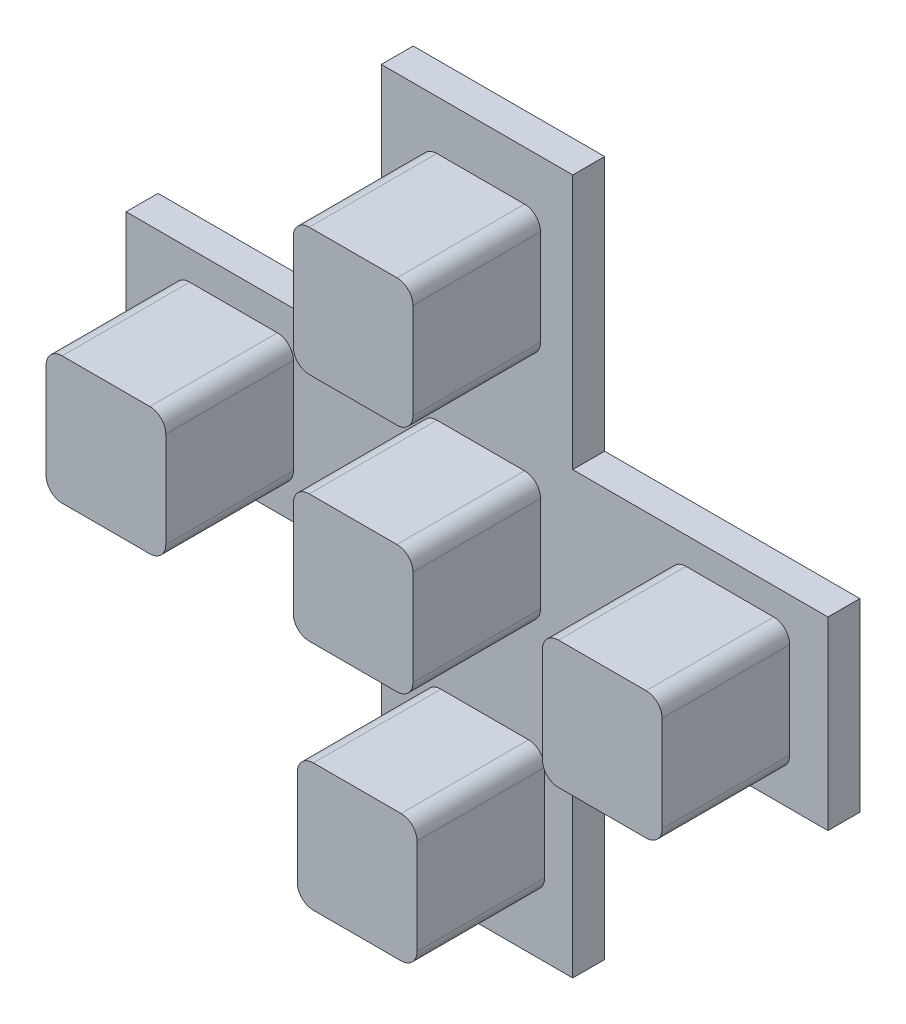
from build123d import *

# Parameters (mm, degrees)
SKETCH1_W             = 7.5000007
SKETCH1_H             = 8
BOSS_EXTRUDE1_DEPTH   = 8
BOSS_EXTRUDE1_2_DEPTH = 8
SKETCH1_W_2           = 7.500000349
SKETCH1_H_2           = 7.999999673
BOSS_EXTRUDE1_3_DEPTH = 8
SKETCH1_W_3           = 7.500000699
SKETCH1_H_3           = 7.999999344
BOSS_EXTRUDE1_4_DEPTH = 8
SKETCH1_W_4           = 7.50000035
SKETCH1_H_4           = 7.999999672
BOSS_EXTRUDE1_5_DEPTH = 8
BOSS_EXTRUDE2_DEPTH   = 2
FILLET1_R             = 1
FILLET2_R             = 1
FILLET3_R             = 1
FILLET4_R             = 1
FILLET5_R             = 1
SHELL8_START          = -2
SHELL8_OUTLINE_W      = 5.5000007
SHELL8_OUTLINE_H      = 6
SHELL8_OUTLINE_W_2    = 5.500000349
SHELL8_OUTLINE_H_2    = 5.999999673
SHELL8_OUTLINE_W_3    = 5.500000699
SHELL8_OUTLINE_H_3    = 5.999999344
SHELL8_OUTLINE_W_4    = 5.50000035
SHELL8_OUTLINE_H_4    = 5.999999672
SHELL8_DEPTH          = 9
SHELL8_2_OUTLINE_W    = 5.50000035
SHELL8_2_OUTLINE_H    = 5.999999672
SHELL8_2_OUTLINE_W_2  = 5.500000699
SHELL8_2_OUTLINE_H_2  = 5.999999344
SHELL8_2_OUTLINE_W_3  = 5.5000007
SHELL8_2_OUTLINE_H_3  = 6
SHELL8_2_OUTLINE_W_4  = 5.500000349
SHELL8_2_OUTLINE_H_4  = 5.999999673
SHELL8_2_DEPTH        = 1


# Read off the part's stored shape, not the designer's step: Shell8
with BuildPart() as part:
    # Sketch1 → Boss-Extrude1 (new body)
    with BuildSketch(Plane.XY):
        with Locations((-28.369785759, -4.064003029)):
            Rectangle(SKETCH1_W, SKETCH1_H)
    extrude(amount=BOSS_EXTRUDE1_DEPTH)



with BuildPart() as body_2:
    # Sketch1 → Boss-Extrude1 2 (new body)
    with BuildSketch(Plane.XY):
        with Locations((-28.369785759, -18.542000511)):
            Rectangle(SKETCH1_W, SKETCH1_H)
    extrude(amount=BOSS_EXTRUDE1_2_DEPTH)


with BuildPart() as body_3:
    # Sketch1 → Boss-Extrude1 3 (new body)
    with BuildSketch(Plane.XY):
        with Locations((-12.748787377, -18.668999085)):
            Rectangle(SKETCH1_W_2, SKETCH1_H_2)
    extrude(amount=BOSS_EXTRUDE1_3_DEPTH)


with BuildPart() as body_4:
    # Sketch1 → Boss-Extrude1 4 (new body)
    with BuildSketch(Plane.XY):
        with Locations((-28.115787957, -33.019997009)):
            Rectangle(SKETCH1_W_3, SKETCH1_H_3)
    extrude(amount=BOSS_EXTRUDE1_4_DEPTH)


with BuildPart() as body_5:
    # Sketch1 → Boss-Extrude1 5 (new body)
    with BuildSketch(Plane.XY):
        with Locations((-43.86378524, -18.795997986)):
            Rectangle(SKETCH1_W_4, SKETCH1_H_4)
    extrude(amount=BOSS_EXTRUDE1_5_DEPTH)


with BuildPart() as part_1:
    add(part.part)

    add(body_2.part)  # Boss-Extrude2 merges body 2

    add(body_3.part)  # Boss-Extrude2 merges body 3

    add(body_4.part)  # Boss-Extrude2 merges body 4

    add(body_5.part)  # Boss-Extrude2 merges body 5
    # Sketch3 → Boss-Extrude2 (add)
    with BuildSketch(Plane(origin=(0, 0, 0), x_dir=(-1, 0, 0), z_dir=(0, 0, -1))):
        Polygon((22.599963615, -12.968328574), (6.599963615, -12.968328574), (6.599963615, -24.568328574), (22.599963615, -24.568328574), (22.599963615, -40.568328574), (34.599963615, -40.568328574), (34.599963615, -24.568328574), (50.599963615, -24.568328574), (50.599963615, -12.968328574), (34.599963615, -12.968328574), (34.599963615, 3.031671426), (22.599963615, 3.031671426), align=None)
    extrude(amount=BOSS_EXTRUDE2_DEPTH)

    # Fillet1
    fillet1_edges = [part_1.edges().sort_by_distance(p)[0] for p in [
        (-31.865788306, -29.019997337, 4),
        (-31.865788306, -37.019996681, 4),
        (-24.365787607, -37.019996681, 4),
        (-24.365787607, -29.019997337, 4),
    ]]
    fillet(fillet1_edges, radius=FILLET1_R)

    # Fillet2
    fillet2_edges = [part_1.edges().sort_by_distance(p)[0] for p in [
        (-32.119786109, -14.542000511, 4),
        (-32.119786109, -22.542000511, 4),
        (-24.619785409, -22.542000511, 4),
        (-24.619785409, -14.542000511, 4),
    ]]
    fillet(fillet2_edges, radius=FILLET2_R)

    # Fillet3
    fillet3_edges = [part_1.edges().sort_by_distance(p)[0] for p in [
        (-47.613785415, -14.79599815, 4),
        (-47.613785415, -22.795997822, 4),
        (-40.113785065, -22.795997822, 4),
        (-40.113785065, -14.79599815, 4),
    ]]
    fillet(fillet3_edges, radius=FILLET3_R)

    # Fillet4
    fillet4_edges = [part_1.edges().sort_by_distance(p)[0] for p in [
        (-32.119786109, -0.064003029, 4),
        (-24.619785409, -0.064003029, 4),
        (-24.619785409, -8.064003029, 4),
        (-32.119786109, -8.064003029, 4),
    ]]
    fillet(fillet4_edges, radius=FILLET4_R)

    # Fillet5
    fillet5_edges = [part_1.edges().sort_by_distance(p)[0] for p in [
        (-16.498787551, -14.668999248, 4),
        (-16.498787551, -22.668998921, 4),
        (-8.998787202, -22.668998921, 4),
        (-8.998787202, -14.668999248, 4),
    ]]
    fillet(fillet5_edges, radius=FILLET5_R)

    # Shell8 outline → Shell8 (cut)
    with BuildSketch(Plane.XY.offset(SHELL8_START)):
        with Locations((-28.369785759, -4.064003029)):
            Rectangle(SHELL8_OUTLINE_W, SHELL8_OUTLINE_H)
        with Locations((-28.369785759, -18.542000511)):
            Rectangle(SHELL8_OUTLINE_W, SHELL8_OUTLINE_H)
        with Locations((-12.748787377, -18.668999085)):
            Rectangle(SHELL8_OUTLINE_W_2, SHELL8_OUTLINE_H_2)
        with Locations((-28.115787957, -33.019997009)):
            Rectangle(SHELL8_OUTLINE_W_3, SHELL8_OUTLINE_H_3)
        with Locations((-43.86378524, -18.795997986)):
            Rectangle(SHELL8_OUTLINE_W_4, SHELL8_OUTLINE_H_4)
    extrude(amount=SHELL8_DEPTH, mode=Mode.SUBTRACT)

    # Shell8 2 outline → Shell8 2 (cut)
    with BuildSketch(Plane.XY.offset(SHELL8_START)):
        Polygon((-23.599963615, -13.968328574), (-23.599963615, 2.031671426), (-33.599963615, 2.031671426), (-33.599963615, -13.968328574), (-49.599963615, -13.968328574), (-49.599963615, -23.568328574), (-33.599963615, -23.568328574), (-33.599963615, -39.568328574), (-23.599963615, -39.568328574), (-23.599963615, -23.568328574), (-7.599963615, -23.568328574), (-7.599963615, -13.968328574), align=None)
        with Locations((-43.86378524, -18.795997986)):
            Rectangle(SHELL8_2_OUTLINE_W, SHELL8_2_OUTLINE_H, mode=Mode.SUBTRACT)
        with Locations((-28.115787957, -33.019997009)):
            Rectangle(SHELL8_2_OUTLINE_W_2, SHELL8_2_OUTLINE_H_2, mode=Mode.SUBTRACT)
        with Locations((-28.369785759, -18.542000511)):
            Rectangle(SHELL8_2_OUTLINE_W_3, SHELL8_2_OUTLINE_H_3, mode=Mode.SUBTRACT)
        with Locations((-12.748787377, -18.668999085)):
            Rectangle(SHELL8_2_OUTLINE_W_4, SHELL8_2_OUTLINE_H_4, mode=Mode.SUBTRACT)
        with Locations((-28.369785759, -4.064003029)):
            Rectangle(SHELL8_2_OUTLINE_W_3, SHELL8_2_OUTLINE_H_3, mode=Mode.SUBTRACT)
    extrude(amount=SHELL8_2_DEPTH, mode=Mode.SUBTRACT)


solid = part_1.part
